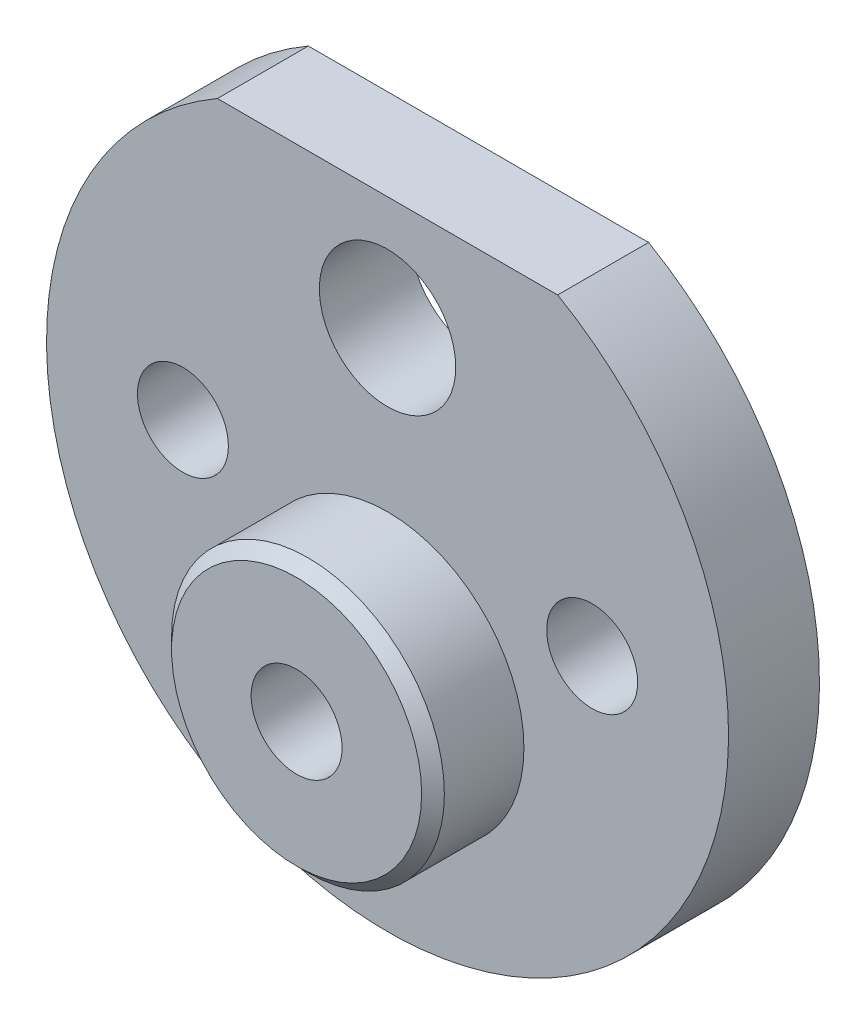
from build123d import *

# Parameters (mm, degrees)
SKETCH1_R           = 3
SKETCH1_R_2         = 2
BOSS_EXTRUDE1_DEPTH = 4
SKETCH2_R           = 6
BOSS_EXTRUDE2_DEPTH = 4
SKETCH3_R           = 2
CUT_EXTRUDE1_DEPTH  = 23.671568098
CHAMFER1_SIZE       = 0.5


with BuildPart() as part:
    # Sketch1 → Boss-Extrude1 (new body)
    with BuildSketch(Plane.XY):
        with BuildLine():
            Line((-7.483314774, 13), (7.483314774, 13))
            ThreePointArc((7.483314774, 13), (0, -15), (-7.483314774, 13))
        make_face()
        with Locations((0, 8)):
            Circle(SKETCH1_R, mode=Mode.SUBTRACT)
        with Locations((-9, 0)):
            Circle(SKETCH1_R_2, mode=Mode.SUBTRACT)
        with Locations((9, 0)):
            Circle(SKETCH1_R_2, mode=Mode.SUBTRACT)
    extrude(amount=BOSS_EXTRUDE1_DEPTH)

    # Sketch2 → Boss-Extrude2 (add)
    with BuildSketch(Plane.XY.offset(4)):
        with Locations((0, -5)):
            Circle(SKETCH2_R)
    extrude(amount=BOSS_EXTRUDE2_DEPTH)

    # Sketch3 → Cut-Extrude1 (cut, through all)
    with BuildSketch(Plane.XY.offset(8)):
        with Locations((0, -5)):
            Circle(SKETCH3_R)
    extrude(amount=-CUT_EXTRUDE1_DEPTH, mode=Mode.SUBTRACT)

    # Chamfer1
    chamfer1_edges = [part.edges().sort_by_distance(p)[0] for p in [
        (-6, -5, 8),
    ]]
    chamfer(chamfer1_edges, length=CHAMFER1_SIZE)


solid = part.part
